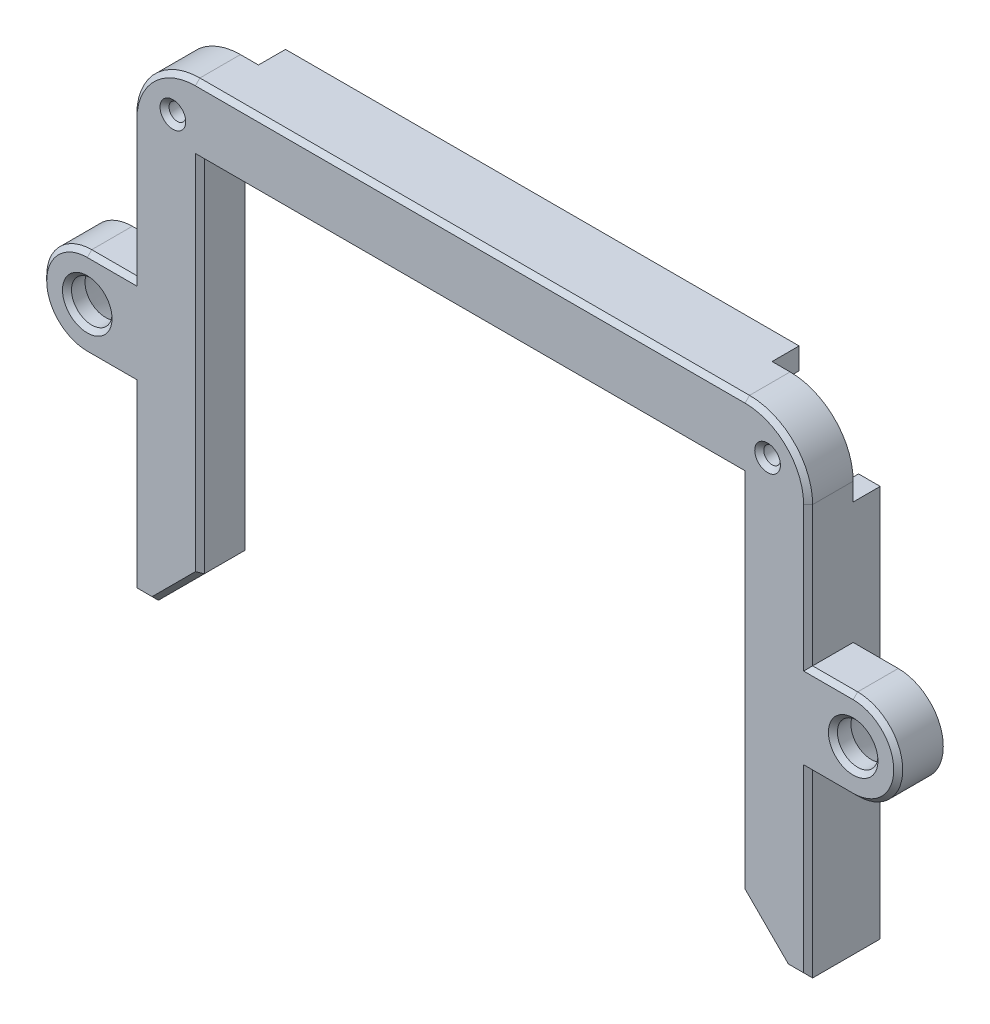
from build123d import *
from OCP.BRepFilletAPI import BRepFilletAPI_MakeChamfer

# Parameters (mm, degrees)
SKETCH1_R           = 0.925
BOSS_EXTRUDE1_DEPTH = 5
BOSS_EXTRUDE2_DEPTH = 3
SKETCH7_W           = 9
SKETCH7_H           = 9
CUT_EXTRUDE3_DEPTH  = 47.770717335
SKETCH3_R           = 2.25
BOSS_EXTRUDE3_DEPTH = 5
SKETCH4_R           = 3.5
CUT_EXTRUDE1_DEPTH  = 3
CHAMFER2_SIZE       = 5.1
FILLET1_R           = 7
CHAMFER3_SIZE       = 0.5
CHAMFER1_SIZE       = 1.25
CHAMFER1_SIZE_2     = 2.5


with BuildPart() as part:
    # Sketch1 → Boss-Extrude1 (new body)
    with BuildSketch(Plane.XY):
        Polygon((-30, -25), (-30, 20), (30, 20), (30, -25), (37.5, -25), (37.5, 27.5), (-37.5, 27.5), (-37.5, -25), align=None)
        with Locations((-33, 23)):
            Circle(SKETCH1_R, mode=Mode.SUBTRACT)
        with Locations((33, 23)):
            Circle(SKETCH1_R, mode=Mode.SUBTRACT)
    extrude(amount=BOSS_EXTRUDE1_DEPTH)

    # Sketch2 → Boss-Extrude2 (add)
    with BuildSketch(Plane.XY):
        Polygon((37.5, 27.5), (30, 27.5), (-30, 27.5), (-37.5, 27.5), (-37.5, -25), (-35.1, -25), (-35.1, 25.1), (35.1, 25.1), (35.1, -25), (37.5, -25), align=None)
    extrude(amount=-BOSS_EXTRUDE2_DEPTH)

    # Sketch7 → Cut-Extrude3 (cut, through all)
    with BuildSketch(Plane(origin=(0, 0, 0), x_dir=(-1, 0, 0), z_dir=(0, 0, -1))):
        with Locations((-33, 23)):
            Rectangle(SKETCH7_W, SKETCH7_H)
        with Locations((33, 23)):
            Rectangle(SKETCH7_W, SKETCH7_H)
    extrude(amount=CUT_EXTRUDE3_DEPTH, mode=Mode.SUBTRACT)

    # Sketch3 → Boss-Extrude3 (add)
    # profile 1 of 2: a face of its own
    with BuildSketch(Plane.XY):
        with BuildLine():
            Line((42.5, 5), (37.5, 5))
            Line((37.5, 5), (37.5, -5))
            Line((37.5, -5), (42.5, -5))
            ThreePointArc((42.5, -5), (47.5, 0), (42.5, 5))
        make_face()
        with Locations(Location((42.5, 0, 0), (0, 0, 180))):
            Circle(SKETCH3_R, mode=Mode.SUBTRACT)
    # profile 2 of 2: a face of its own
    with BuildSketch(Plane.XY):
        with BuildLine():
            Line((-42.5, 5), (-37.5, 5))
            Line((-37.5, 5), (-37.5, -5))
            Line((-37.5, -5), (-42.5, -5))
            ThreePointArc((-42.5, -5), (-47.5, 0), (-42.5, 5))
        make_face()
        with Locations(Location((-42.5, 0, 0), (0, 0, 180))):
            Circle(SKETCH3_R, mode=Mode.SUBTRACT)
    extrude(amount=BOSS_EXTRUDE3_DEPTH)

    # Sketch4 → Cut-Extrude1 (cut)
    with BuildSketch(Plane(origin=(0, 0, 0), x_dir=(-1, 0, 0), z_dir=(0, 0, -1))):
        with Locations((-42.5, 0)):
            Circle(SKETCH4_R)
        with Locations((42.5, 0)):
            Circle(SKETCH4_R)
    extrude(amount=-CUT_EXTRUDE1_DEPTH, mode=Mode.SUBTRACT)

    # Chamfer2
    chamfer2_edges = [part.edges().sort_by_distance(p)[0] for p in [
        (-30, -25, 2.5),
        (30, -25, 2.5),
    ]]
    chamfer(chamfer2_edges, length=CHAMFER2_SIZE)

    # Fillet1
    fillet1_edges = [part.edges().sort_by_distance(p)[0] for p in [
        (-37.5, 27.5, 2.5),
        (37.5, 27.5, 2.5),
    ]]
    fillet(fillet1_edges, radius=FILLET1_R)

    # Chamfer3
    chamfer3_edges = [part.edges().sort_by_distance(p)[0] for p in [
        (37.5, 12.75, 5),
        (47.5, 0, 5),
        (40, 5, 5),
        (40, -5, 5),
        (44.75, 0, 5),
        (-37.5, -15, 5),
        (-47.5, 0, 5),
        (-40, -5, 5),
        (-40, 5, 5),
        (-40.25, 0, 5),
        (0, 20, 5),
        (-30, 0.05, 5),
        (36.3, -25, 5),
        (32.55, -22.45, 5),
        (-32.55, -22.45, 5),
        (-37.5, 12.75, 5),
        (0, 27.5, 5),
        (35.449747468, 25.449747468, 5),
        (-35.449747468, 25.449747468, 5),
        (30, 0.05, 5),
        (-33.925, 23, 0),
        (-33.925, 23, 5),
        (37.5, -15, 5),
        (32.075, 23, 0),
        (32.075, 23, 5),
        (-36.3, -25, 5),
    ]]
    chamfer(chamfer3_edges, length=CHAMFER3_SIZE)

    # Chamfer1
    chamfer1_edges_1 = [part.edges().sort_by_distance(p)[0] for p in [
        (46, 0, 3),
    ]]
    chamfer1_side_1 = [part.faces().sort_by_distance(p)[0] for p in [
        (45.975, 0, 3),
    ]]
    chamfer1_edges_2 = [part.edges().sort_by_distance(p)[0] for p in [
        (-39, 0, 3),
    ]]
    chamfer1_side_2 = [part.faces().sort_by_distance(p)[0] for p in [
        (-39.025, 0, 3),
    ]]
    chamfer1 = BRepFilletAPI_MakeChamfer(part.part.solid().wrapped)
    for e in chamfer1_edges_1:
        chamfer1.Add(CHAMFER1_SIZE - 0.0001, CHAMFER1_SIZE_2 - 0.0001, e.wrapped, chamfer1_side_1[0].wrapped)
    for e in chamfer1_edges_2:
        chamfer1.Add(CHAMFER1_SIZE - 0.0001, CHAMFER1_SIZE_2 - 0.0001, e.wrapped, chamfer1_side_2[0].wrapped)
    add(Compound.cast(chamfer1.Shape()), mode=Mode.REPLACE)  # a hair under: the kernel refuses the full size


solid = part.part
